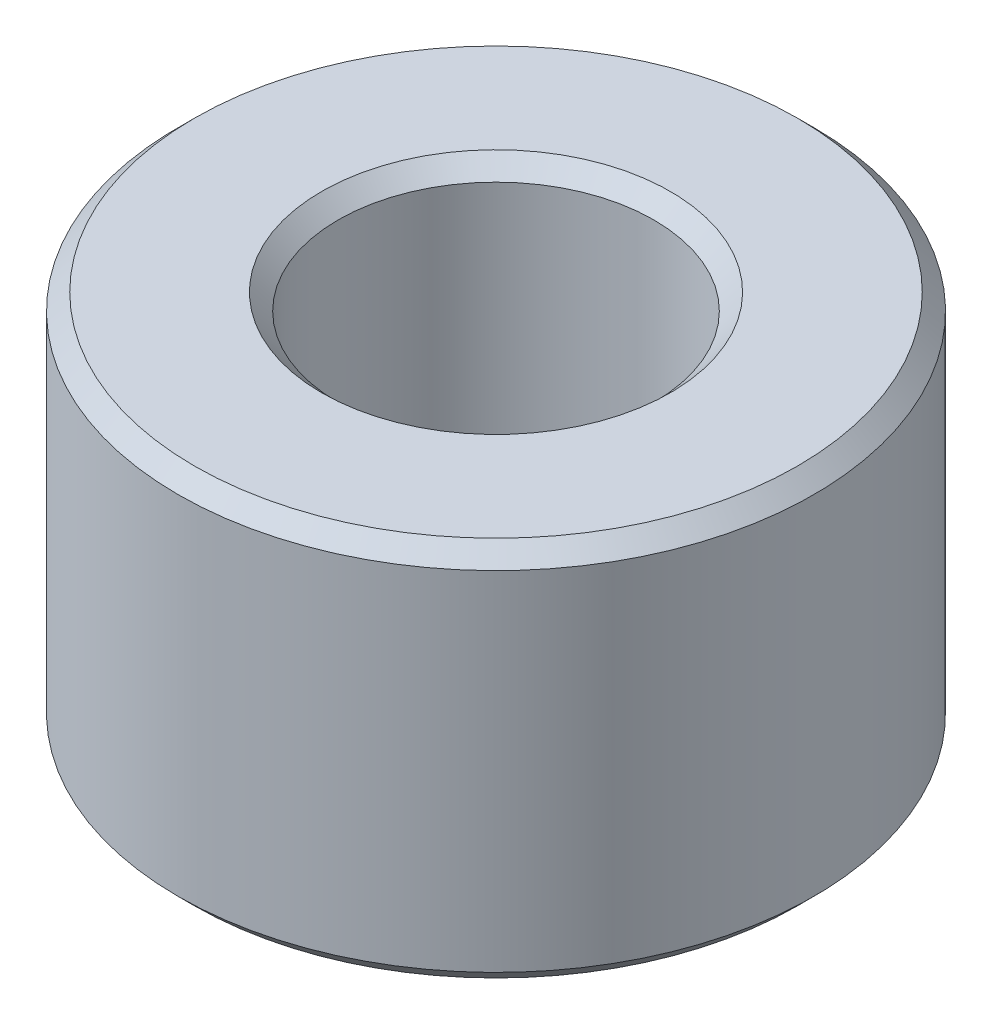
from build123d import *

# Parameters (mm, degrees)
SKETCH1_R           = 55
BOSS_EXTRUDE1_DEPTH = 65.89997587
SKETCH2_R           = 27.327474708
CUT_EXTRUDE1_DEPTH  = 102.945116703
CHAMFER1_SIZE       = 2.845651669


with BuildPart() as part:
    # Sketch1 → Boss-Extrude1 (new body)
    with BuildSketch(Plane(origin=(0, 0, 0), x_dir=(1, 0, 0), z_dir=(0, 1, 0))):
        Circle(SKETCH1_R)
    extrude(amount=BOSS_EXTRUDE1_DEPTH)

    # Sketch2 → Cut-Extrude1 (cut, through all)
    with BuildSketch(Plane(origin=(0, 0, 0), x_dir=(1, 0, 0), z_dir=(0, 1, 0))):
        Circle(SKETCH2_R)
    extrude(amount=CUT_EXTRUDE1_DEPTH, mode=Mode.SUBTRACT)

    # Chamfer1
    chamfer1_edges = [part.edges().sort_by_distance(p)[0] for p in [
        (-27.327474708, 65.89997587, 0),
        (-27.327474708, 0, 0),
        (-55, 0, 0),
        (-55, 65.89997587, 0),
    ]]
    chamfer(chamfer1_edges, length=CHAMFER1_SIZE)


solid = part.part
